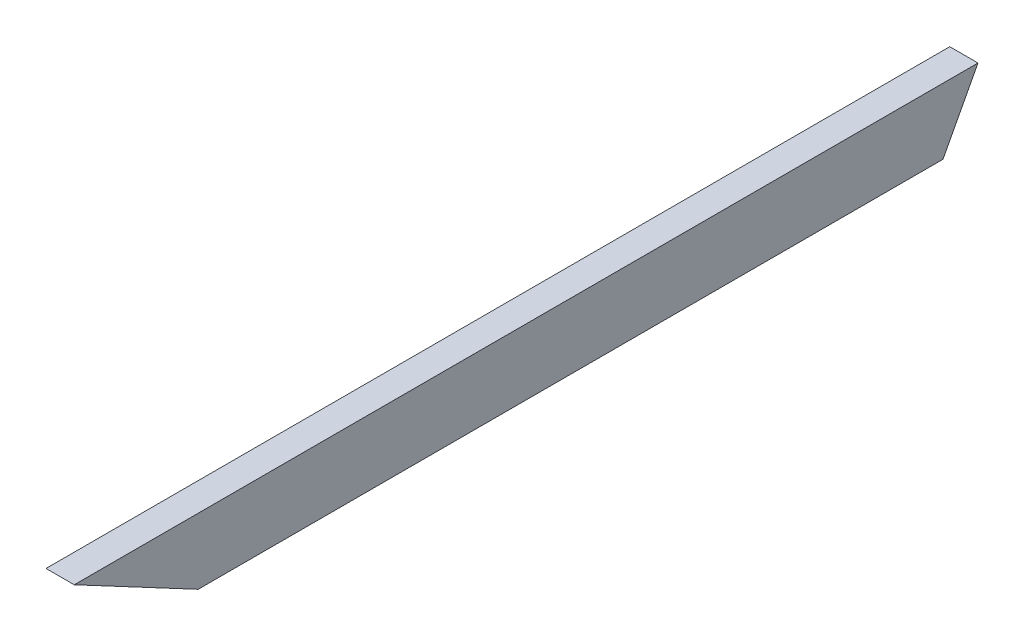
from build123d import *

# Parameters (mm, degrees)
SKETCH1_W           = 38.1
SKETCH1_H           = 88.9
BOSS_EXTRUDE1_DEPTH = 1219.2
CUT_EXTRUDE1_DEPTH  = 1224.030441158
CUT_EXTRUDE2_DEPTH  = 1224.030441158


with BuildPart() as part:
    # Sketch1 → Boss-Extrude1 (new body)
    with BuildSketch(Plane.XY):
        with Locations((19.05, 44.45)):
            Rectangle(SKETCH1_W, SKETCH1_H)
    extrude(amount=BOSS_EXTRUDE1_DEPTH)

    # Sketch2 → Cut-Extrude1 (cut, through all)
    with BuildSketch(Plane(origin=(38.1, 0, 0), x_dir=(0, 0, -1), z_dir=(1, 0, 0))):
        Polygon((-1219.2, 88.9), (-1052.003417231, 0), (-1219.2, 0), align=None)
    extrude(amount=-CUT_EXTRUDE1_DEPTH, mode=Mode.SUBTRACT)

    # Sketch3 → Cut-Extrude2 (cut, through all)
    with BuildSketch(Plane(origin=(38.1, 0, 0), x_dir=(0, 0, -1), z_dir=(1, 0, 0))):
        Polygon((0, 88.9), (-47.268968475, 0), (0, 0), align=None)
    extrude(amount=-CUT_EXTRUDE2_DEPTH, mode=Mode.SUBTRACT)


solid = part.part
